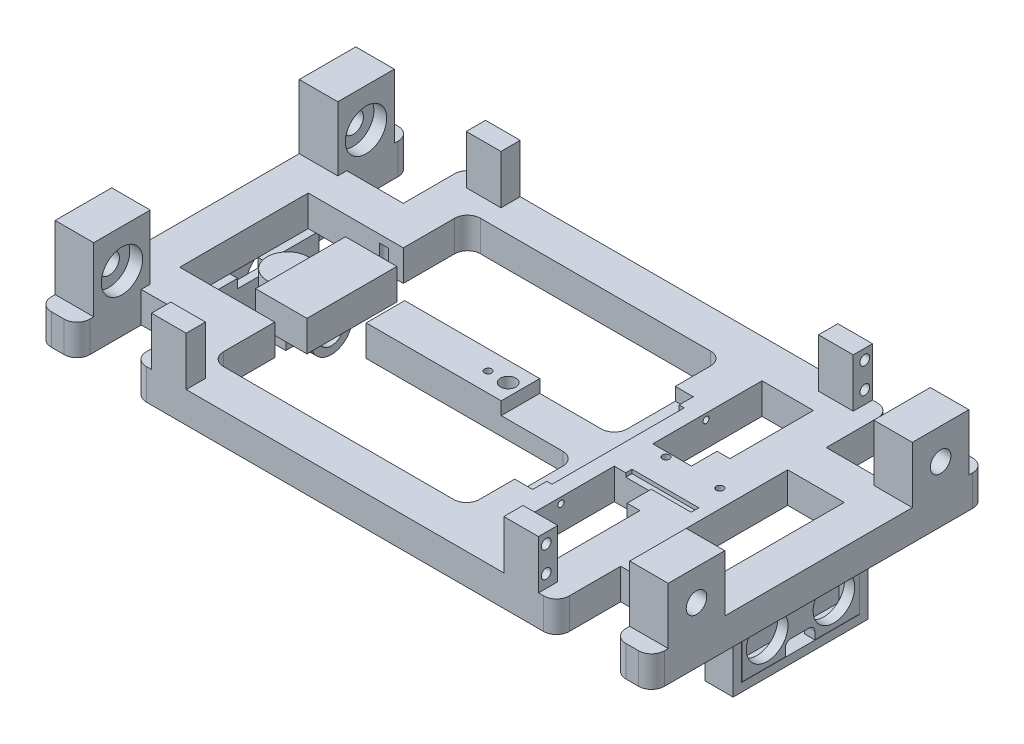
from build123d import *
from build123d.topology import SkipClean

# Parameters (mm, degrees)
BOSS_EXTRUDE1_DEPTH    = 12
SKETCH2_W              = 12
SKETCH2_H              = 7.5
BOSS_EXTRUDE2_DEPTH    = 19
SKETCH3_R              = 1.9
CUT_EXTRUDE1_DEPTH     = 208.497373477
SKETCH4_W              = 22
SKETCH4_H              = 22
SKETCH4_R              = 8.05
BOSS_EXTRUDE3_DEPTH    = 5
BOSS_EXTRUDE3_2_DEPTH  = 5
SKETCH6_W              = 22
SKETCH6_H              = 22
SKETCH6_R              = 4
BOSS_EXTRUDE4_DEPTH    = 6
SKETCH7_W              = 22
SKETCH7_H              = 15
BOSS_EXTRUDE5_DEPTH    = 12
SKETCH8_W              = 22
SKETCH8_H              = 50
CUT_EXTRUDE2_DEPTH     = 138.628085796
SKETCH14_W             = 15
SKETCH14_H             = 42.5
BOSS_EXTRUDE8_DEPTH    = 12
SKETCH16_W             = 15
SKETCH16_H             = 42.5
CUT_EXTRUDE8_DEPTH     = 138.628085796
SKETCH17_W             = 15
SKETCH17_H             = 42.5
BOSS_EXTRUDE9_DEPTH    = 12
SKETCH15_W             = 36
SKETCH15_H             = 62.5
CUT_EXTRUDE9_DEPTH     = 5
CUT_EXTRUDE10_REACH    = 176.743
SKETCH18_R             = 1.2
SKETCH19_W             = 51.5
SKETCH19_H             = 7
CUT_EXTRUDE11_DEPTH    = 2
SKETCH41_W             = 3
SKETCH41_H             = 52.5
BOSS_EXTRUDE18_DEPTH   = 24
BOSS_EXTRUDE19_DEPTH   = 8
BOSS_EXTRUDE22_START   = 5
SKETCH48_R             = 8.1
BOSS_EXTRUDE22_DEPTH   = 4
SKETCH55_W             = 1.5
SKETCH55_H             = 7.5
BOSS_EXTRUDE27_DEPTH   = 19
CUT_EXTRUDE27_DEPTH    = 3
SKETCH60_W             = 11
SKETCH60_H             = 22
BOSS_EXTRUDE28_DEPTH   = 3
SKETCH62_R             = 1.825
CUT_EXTRUDE33_DEPTH    = 9
FILLET4_R              = 5
SKETCH65_W             = 22
SKETCH65_H             = 22
SKETCH65_R             = 4
BOSS_EXTRUDE29_DEPTH   = 4
SKETCH66_W             = 22
SKETCH66_H             = 25
SKETCH66_R             = 4
BOSS_EXTRUDE30_DEPTH   = 4
BOSS_EXTRUDE32_DEPTH   = 1
BOSS_EXTRUDE33_DEPTH   = 1
SKETCH67_W             = 56
SKETCH67_H             = 15
BOSS_EXTRUDE34_DEPTH   = 11
SKETCH70_W             = 12
SKETCH70_H             = 8
CUT_EXTRUDE35_DEPTH    = 13
SKETCH71_W             = 26
SKETCH71_H             = 16.2
CUT_EXTRUDE36_DEPTH    = 19
SKETCH72_W             = 26
SKETCH72_H             = 3
CUT_EXTRUDE37_DEPTH    = 1.5
SKETCH73_R             = 1.4
CUT_EXTRUDE38_DEPTH    = 10
SKETCH74_W             = 6
SKETCH74_H             = 9
BOSS_EXTRUDE35_DEPTH   = 2.5
SKETCH75_W             = 6
SKETCH75_H             = 3
BOSS_EXTRUDE36_DEPTH   = 2.5
BOSS_EXTRUDE36_2_DEPTH = 2.5
SKETCH76_W             = 6
SKETCH76_H             = 12.35
SKETCH76_H_2           = 0.35
SKETCH76_H_3           = 3
BOSS_EXTRUDE37_DEPTH   = 2.7
BOSS_EXTRUDE38_DEPTH   = 6
SKETCH78_W             = 2
SKETCH78_H             = 2
CUT_EXTRUDE39_DEPTH    = 6
SKETCH79_W             = 13.5
SKETCH79_H             = 15.7
BOSS_EXTRUDE39_DEPTH   = 3
SKETCH80_R             = 2.75
CUT_EXTRUDE40_DEPTH    = 3
SKETCH81_R             = 1.4
CUT_EXTRUDE41_DEPTH    = 20
SKETCH82_W             = 6
SKETCH82_H             = 3
CUT_EXTRUDE42_DEPTH    = 5
SKETCH83_W             = 6
SKETCH83_H             = 3
BOSS_EXTRUDE40_DEPTH   = 5
SKETCH84_R             = 3
CUT_EXTRUDE43_DEPTH    = 12
SKETCH85_W             = 7.5
SKETCH85_H             = 5
BOSS_EXTRUDE42_DEPTH   = 7.5
SKETCH86_R             = 2.75
CUT_EXTRUDE44_DEPTH    = 3
SKETCH89_R             = 0.95
CUT_EXTRUDE47_DEPTH    = 8
SKETCH91_R             = 1.75
CUT_EXTRUDE48_DEPTH    = 1.5
SKETCH88_R             = 1.4
CUT_EXTRUDE49_DEPTH    = 10
BOSS_EXTRUDE43_DEPTH   = 12
SKETCH96_W             = 7.5
SKETCH96_H             = 5
BOSS_EXTRUDE44_DEPTH   = 7.5
SKETCH100_W            = 7.5
SKETCH100_H            = 5
BOSS_EXTRUDE45_DEPTH   = 7.5
SKETCH98_R             = 2.75
CUT_EXTRUDE52_DEPTH    = 3
SKETCH101_R            = 1.4
CUT_EXTRUDE53_DEPTH    = 10
BOSS_EXTRUDE46_DEPTH   = 7.5
BOSS_EXTRUDE47_START   = 5
BOSS_EXTRUDE47_DEPTH   = 5
SKETCH104_W            = 55.051082791
SKETCH104_H            = 50.028748178
CUT_EXTRUDE55_DEPTH    = 141.806569449
SKETCH105_W            = 73
SKETCH105_H            = 25
CUT_EXTRUDE56_DEPTH    = 216.02688204


with BuildPart() as part:
    # Sketch1 → Boss-Extrude1 (new body)
    with BuildSketch(Plane(origin=(0, 0, 0), x_dir=(1, 0, 0), z_dir=(0, 1, 0))):
        Polygon((-104.3, -65), (-104.3, -7.5), (-82.3, -7.5), (-82.3, -65), (82.3, -65), (82.3, -7.5), (104.3, -7.5), (104.3, -65), (119.3, -65), (119.3, 65), (104.3, 65), (104.3, 7.5), (82.3, 7.5), (82.3, 65), (-82.3, 65), (-82.3, 7.5), (-104.3, 7.5), (-104.3, 65), (-119.3, 65), (-119.3, -65), align=None)
        Polygon((-67.3, -50), (-67.3, -17.5), (-63.3, -17.5), (-63.3, -7.5), (63.3, -7.5), (63.3, -17.5), (67.3, -17.5), (67.3, -50), align=None, mode=Mode.SUBTRACT)
        Polygon((-67.3, 17.5), (-63.3, 17.5), (-63.3, 7.5), (63.3, 7.5), (63.3, 17.5), (67.3, 17.5), (67.3, 50), (-67.3, 50), align=None, mode=Mode.SUBTRACT)
    extrude(amount=BOSS_EXTRUDE1_DEPTH)

    # Sketch2 → Boss-Extrude2 (add)
    with BuildSketch(Plane(origin=(0, 12, 0), x_dir=(1, 0, 0), z_dir=(0, 1, 0))):
        with Locations((-69.3, 61.25)):
            Rectangle(SKETCH2_W, SKETCH2_H)
        with Locations((-69.3, -61.25)):
            Rectangle(SKETCH2_W, SKETCH2_H)
        Polygon((-63.3, -7.5), (-63.3, 0), (-63.3, 7.5), (-63.3, 17.5), (-75.3, 17.5), (-75.3, 7.5), (-75.3, 0), (-75.3, -7.5), (-75.3, -17.5), (-63.3, -17.5), align=None)
        with Locations((69.3, -61.25)):
            Rectangle(SKETCH2_W, SKETCH2_H)
        Polygon((75.3, 7.5), (75.3, 0), (75.3, -7.5), (75.3, -17.5), (63.3, -17.5), (63.3, -7.5), (63.3, 0), (63.3, 7.5), (63.3, 17.5), (75.3, 17.5), align=None)
        with Locations((69.3, 61.25)):
            Rectangle(SKETCH2_W, SKETCH2_H)
    extrude(amount=BOSS_EXTRUDE2_DEPTH)

    # Sketch3 → Cut-Extrude1 (cut, through all)
    with BuildSketch(Plane.ZY.offset(75.3)):
        with Locations((-62, 17)):
            Circle(SKETCH3_R)
        with Locations((-62, 27)):
            Circle(SKETCH3_R)
        with Locations((-13, 17)):
            Circle(SKETCH3_R)
        with Locations((-13, 27)):
            Circle(SKETCH3_R)
        with Locations((13, 27)):
            Circle(SKETCH3_R)
        with Locations((13, 17)):
            Circle(SKETCH3_R)
        with Locations((62, 17)):
            Circle(SKETCH3_R)
        with Locations((62, 27)):
            Circle(SKETCH3_R)
    extrude(amount=-CUT_EXTRUDE1_DEPTH, mode=Mode.SUBTRACT)



with BuildPart() as body_2:
    # Sketch4 → Boss-Extrude3 (new body)
    with BuildSketch(Plane.ZY.offset(-104.3)):
        with Locations((-47.5, 23)):
            Rectangle(SKETCH4_W, SKETCH4_H)
        with Locations(Location((-47.5, 22, 0), (0, 0, 180))):
            Circle(SKETCH4_R, mode=Mode.SUBTRACT)
    extrude(amount=-BOSS_EXTRUDE3_DEPTH)


with BuildPart() as body_3:
    # Sketch4 → Boss-Extrude3 2 (new body)
    with BuildSketch(Plane.ZY.offset(-104.3)):
        with Locations((47.5, 23)):
            Rectangle(SKETCH4_W, SKETCH4_H)
        with Locations((47.5, 22)):
            Circle(SKETCH4_R, mode=Mode.SUBTRACT)
    extrude(amount=-BOSS_EXTRUDE3_2_DEPTH)


    add(body_2.part)  # Boss-Extrude4 merges body 2
    # Sketch6 → Boss-Extrude4 (add)
    # profile 1 of 2: a face of its own
    with BuildSketch(Plane(origin=(109.3, 0, 0), x_dir=(0, 0, -1), z_dir=(1, 0, 0))):
        with Locations((-47.5, 23)):
            Rectangle(SKETCH6_W, SKETCH6_H)
        with Locations((-47.5, 22)):
            Circle(SKETCH6_R, mode=Mode.SUBTRACT)
    # profile 2 of 2: a face of its own
    with BuildSketch(Plane(origin=(109.3, 0, 0), x_dir=(0, 0, -1), z_dir=(1, 0, 0))):
        with Locations((47.5, 23)):
            Rectangle(SKETCH6_W, SKETCH6_H)
        with Locations((47.5, 22)):
            Circle(SKETCH6_R, mode=Mode.SUBTRACT)
    extrude(amount=BOSS_EXTRUDE4_DEPTH)


with BuildPart() as body_3_2:
    # Mirror1: mirrored copy
    add(body_3.part.mirror(Plane(origin=(0, 0, 0), x_dir=(0, 0, 1), z_dir=(1, 0, 0))))


with BuildPart() as part_1:
    add(part.part)

    add(body_3.part)  # Boss-Extrude5 merges body 3

    add(body_3_2.part)  # Boss-Extrude5 merges body 3 2
    # Sketch7 → Boss-Extrude5 (add)
    with BuildSketch(Plane(origin=(0, 0, 0), x_dir=(1, 0, 0), z_dir=(0, 1, 0))):
        with Locations((-93.3, 32.5)):
            Rectangle(SKETCH7_W, SKETCH7_H)
        with Locations((93.3, 32.5)):
            Rectangle(SKETCH7_W, SKETCH7_H)
        with Locations((93.3, -32.5)):
            Rectangle(SKETCH7_W, SKETCH7_H)
        with Locations((-93.3, -32.5)):
            Rectangle(SKETCH7_W, SKETCH7_H)
    extrude(amount=BOSS_EXTRUDE5_DEPTH)

    # Sketch8 → Cut-Extrude2 (cut, through all)
    with BuildSketch(Plane(origin=(0, 12, 0), x_dir=(1, 0, 0), z_dir=(0, 1, 0))):
        with Locations((-93.3, 0)):
            Rectangle(SKETCH8_W, SKETCH8_H)
        with Locations((93.3, 0)):
            Rectangle(SKETCH8_W, SKETCH8_H)
    extrude(amount=-CUT_EXTRUDE2_DEPTH, mode=Mode.SUBTRACT)

    # Sketch14 → Boss-Extrude8 (add)
    with BuildSketch(Plane(origin=(0, 0, 0), x_dir=(1, 0, 0), z_dir=(0, 1, 0))):
        with Locations((0, -28.75)):
            Rectangle(SKETCH14_W, SKETCH14_H)
        with Locations((0, 28.75)):
            Rectangle(SKETCH14_W, SKETCH14_H)
    extrude(amount=BOSS_EXTRUDE8_DEPTH)

    # Sketch16 → Cut-Extrude8 (cut, through all)
    with BuildSketch(Plane(origin=(0, 12, 0), x_dir=(1, 0, 0), z_dir=(0, 1, 0))):
        with Locations((0, 28.75)):
            Rectangle(SKETCH16_W, SKETCH16_H)
        with Locations((0, -28.75)):
            Rectangle(SKETCH16_W, SKETCH16_H)
    extrude(amount=-CUT_EXTRUDE8_DEPTH, mode=Mode.SUBTRACT)

    # Sketch17 → Boss-Extrude9 (add)
    with BuildSketch(Plane(origin=(0, 0, 0), x_dir=(1, 0, 0), z_dir=(0, 1, 0))):
        with Locations((39.800000001, 28.75)):
            Rectangle(SKETCH17_W, SKETCH17_H)
        with Locations((39.800000001, -28.75)):
            Rectangle(SKETCH17_W, SKETCH17_H)
    extrude(amount=BOSS_EXTRUDE9_DEPTH)

    # Sketch15 → Cut-Extrude9 (cut)
    with BuildSketch(Plane(origin=(0, 12, 0), x_dir=(1, 0, 0), z_dir=(0, 1, 0))):
        with Locations((21.3, 0)):
            Rectangle(SKETCH15_W, SKETCH15_H)
    extrude(amount=-CUT_EXTRUDE9_DEPTH, mode=Mode.SUBTRACT)

    # Sketch18 → Cut-Extrude10 (cut, up to next)
    with BuildSketch(Plane.ZY.offset(-39.3), mode=Mode.PRIVATE) as cut_extrude10_sk1:
        with Locations((28.25, 9.7)):
            Circle(SKETCH18_R)
    cut_extrude10_tool1 = extrude(cut_extrude10_sk1.sketch, amount=-CUT_EXTRUDE10_REACH, mode=Mode.PRIVATE) & part_1.part
    # Sketch18 → Cut-Extrude10 (cut, up to next)
    with BuildSketch(Plane.ZY.offset(-39.3), mode=Mode.PRIVATE) as cut_extrude10_sk2:
        with Locations((-28.25, 9.7)):
            Circle(SKETCH18_R)
    cut_extrude10_tool2 = extrude(cut_extrude10_sk2.sketch, amount=-CUT_EXTRUDE10_REACH, mode=Mode.PRIVATE) & part_1.part
    add(cut_extrude10_tool1.solids().sort_by_distance((39.3, 9.7, 28.25))[0], mode=Mode.SUBTRACT)
    add(cut_extrude10_tool2.solids().sort_by_distance((39.3, 9.7, -28.25))[0], mode=Mode.SUBTRACT)

    # Sketch19 → Cut-Extrude11 (cut)
    with BuildSketch(Plane.ZY.offset(-39.3)):
        with Locations((0, 10.5)):
            Rectangle(SKETCH19_W, SKETCH19_H)
    extrude(amount=-CUT_EXTRUDE11_DEPTH, mode=Mode.SUBTRACT)

    # Sketch55 → Boss-Extrude27 (add)
    with BuildSketch(Plane(origin=(0, 12, 0), x_dir=(1, 0, 0), z_dir=(0, 1, 0))):
        with Locations((-62.55, 61.25)):
            Rectangle(SKETCH55_W, SKETCH55_H)
        with Locations((62.55, 61.25)):
            Rectangle(SKETCH55_W, SKETCH55_H)
        with Locations((62.55, -61.25)):
            Rectangle(SKETCH55_W, SKETCH55_H)
        with Locations((-62.55, -61.25)):
            Rectangle(SKETCH55_W, SKETCH55_H)
    extrude(amount=BOSS_EXTRUDE27_DEPTH)

    # Sketch60 → Boss-Extrude28 (add)
    with BuildSketch(Plane(origin=(0, 34, 0), x_dir=(1, 0, 0), z_dir=(0, 1, 0))):
        with Locations((-109.8, 47.5)):
            Rectangle(SKETCH60_W, SKETCH60_H)
        with Locations((-109.8, -47.5)):
            Rectangle(SKETCH60_W, SKETCH60_H)
    extrude(amount=BOSS_EXTRUDE28_DEPTH)

    # Sketch62 → Cut-Extrude33 (cut)
    with BuildSketch(Plane.XZ):
        with Locations(Location((-74.8, 25, 0), (0, 0, 270))):
            Circle(SKETCH62_R)
        with Locations(Location((-74.8, -25, 0), (0, 0, 270))):
            Circle(SKETCH62_R)
        with Locations(Location((-74.8, -57.5, 0), (0, 0, 270))):
            Circle(SKETCH62_R)
        with Locations(Location((-74.8, 57.5, 0), (0, 0, 270))):
            Circle(SKETCH62_R)
        with Locations(Location((0, 57.5, 0), (0, 0, 270))):
            Circle(SKETCH62_R)
        with Locations(Location((0, -57.5, 0), (0, 0, 270))):
            Circle(SKETCH62_R)
        with Locations(Location((74.8, -57.5, 0), (0, 0, 90))):
            Circle(SKETCH62_R)
        with Locations(Location((74.8, -25, 0), (0, 0, 90))):
            Circle(SKETCH62_R)
        with Locations(Location((74.8, 25, 0), (0, 0, 90))):
            Circle(SKETCH62_R)
        with Locations(Location((74.8, 57.5, 0), (0, 0, 90))):
            Circle(SKETCH62_R)
    extrude(amount=-CUT_EXTRUDE33_DEPTH, mode=Mode.SUBTRACT)

    # Fillet4
    fillet4_edges = [part_1.edges().sort_by_distance(p)[0] for p in [
        (-119.3, 6, -65),
        (-104.3, 6, -65),
        (-82.3, 6, -65),
        (82.3, 6, -65),
        (104.3, 6, -65),
        (119.3, 6, -65),
        (119.3, 6, 65),
        (104.3, 6, 65),
        (82.3, 6, 65),
        (-82.3, 6, 65),
        (-104.3, 6, 65),
        (-119.3, 6, 65),
        (32.300000001, 6, -50),
        (32.300000001, 6, 50),
        (32.300000001, 3.5, 7.5),
        (32.300000001, 3.5, -7.5),
        (-67.3, 6, 50),
        (-67.3, 6, -50),
    ]]
    fillet(fillet4_edges, radius=FILLET4_R)

    # Sketch65 → Boss-Extrude29 (add)
    # profile 1 of 2: a face of its own
    with BuildSketch(Plane(origin=(115.3, 0, 0), x_dir=(0, 0, -1), z_dir=(1, 0, 0))):
        with Locations((-47.5, 23)):
            Rectangle(SKETCH65_W, SKETCH65_H)
        with Locations(Location((-47.5, 22, 0), (0, 0, 180))):
            Circle(SKETCH65_R, mode=Mode.SUBTRACT)
    # profile 2 of 2: a face of its own
    with BuildSketch(Plane(origin=(115.3, 0, 0), x_dir=(0, 0, -1), z_dir=(1, 0, 0))):
        with Locations((47.5, 23)):
            Rectangle(SKETCH65_W, SKETCH65_H)
        with Locations(Location((47.5, 22, 0), (0, 0, 180))):
            Circle(SKETCH65_R, mode=Mode.SUBTRACT)
    extrude(amount=BOSS_EXTRUDE29_DEPTH)

    # Sketch66 → Boss-Extrude30 (add)
    # profile 1 of 2: a face of its own
    with SkipClean():  # the faces are left unmerged after this step: merging them gives an invalid solid
        with BuildSketch(Plane.ZY.offset(115.3)):
            with Locations((-47.5, 24.5)):
                Rectangle(SKETCH66_W, SKETCH66_H)
            with Locations((-47.5, 22)):
                Circle(SKETCH66_R, mode=Mode.SUBTRACT)
        # profile 2 of 2: a face of its own
        with BuildSketch(Plane.ZY.offset(115.3)):
            with Locations((47.5, 24.5)):
                Rectangle(SKETCH66_W, SKETCH66_H)
            with Locations((47.5, 22)):
                Circle(SKETCH66_R, mode=Mode.SUBTRACT)
        extrude(amount=BOSS_EXTRUDE30_DEPTH)
    add(part_1.part.scale(1), mode=Mode.REPLACE)  # the faces are merged on a copy

    # Sketch68 → Boss-Extrude32 (add)
    with SkipClean():  # the faces are left unmerged after this step: merging them gives an invalid solid
        with BuildSketch(Plane(origin=(-63.3, 0, 0), x_dir=(0, 0, -1), z_dir=(1, 0, 0))):
            Polygon((-17.5, 0), (-7.5, 0), (-7.5, 12), (7.5, 12), (7.5, 0), (17.5, 0), (17.5, 31), (-17.5, 31), align=None)
        extrude(amount=BOSS_EXTRUDE32_DEPTH)

    # Sketch69 → Boss-Extrude33 (add)
    with SkipClean():  # the faces are left unmerged after this step: merging them gives an invalid solid
        with BuildSketch(Plane.ZY.offset(-63.3)):
            Polygon((7.5, 0), (17.5, 0), (17.5, 31), (-17.5, 31), (-17.5, 0), (-7.5, 0), (-7.5, 12), (7.5, 12), align=None)
        extrude(amount=BOSS_EXTRUDE33_DEPTH)

    # Sketch67 → Boss-Extrude34 (add)
    with SkipClean():  # the faces are left unmerged after this step: merging them gives an invalid solid
        with BuildSketch(Plane(origin=(0, 12, 0), x_dir=(1, 0, 0), z_dir=(0, 1, 0))):
            with Locations((-34.3, 0)):
                Rectangle(SKETCH67_W, SKETCH67_H)
        extrude(amount=BOSS_EXTRUDE34_DEPTH)

    # Sketch70 → Cut-Extrude35 (cut)
    with SkipClean():  # the faces are left unmerged after this step: merging them gives an invalid solid
        with BuildSketch(Plane.ZY.offset(75.3)):
            with Locations((0, 27)):
                Rectangle(SKETCH70_W, SKETCH70_H)
        extrude(amount=-CUT_EXTRUDE35_DEPTH, mode=Mode.SUBTRACT)

    # Sketch71 → Cut-Extrude36 (cut)
    with SkipClean():  # the faces are left unmerged after this step: merging them gives an invalid solid
        with BuildSketch(Plane(origin=(0, 31, 0), x_dir=(1, 0, 0), z_dir=(0, 1, 0))):
            with Locations((69.3, 0)):
                Rectangle(SKETCH71_W, SKETCH71_H)
        extrude(amount=-CUT_EXTRUDE36_DEPTH, mode=Mode.SUBTRACT)

    # Sketch72 → Cut-Extrude37 (cut)
    with SkipClean():  # the faces are left unmerged after this step: merging them gives an invalid solid
        with BuildSketch(Plane(origin=(0, 12, 0), x_dir=(1, 0, 0), z_dir=(0, 1, 0))):
            with Locations((64.8, -6.6)):
                Rectangle(SKETCH72_W, SKETCH72_H)
        extrude(amount=-CUT_EXTRUDE37_DEPTH, mode=Mode.SUBTRACT)

    # Sketch73 → Cut-Extrude38 (cut)
    with SkipClean():  # the faces are left unmerged after this step: merging them gives an invalid solid
        with BuildSketch(Plane(origin=(0, 12, 0), x_dir=(1, 0, 0), z_dir=(0, 1, 0))):
            with Locations(Location((54.3, 5.6, 0), (0, 0, 270))):
                Circle(SKETCH73_R)
            with Locations(Location((75.3, 5.6, 0), (0, 0, 270))):
                Circle(SKETCH73_R)
        extrude(amount=-CUT_EXTRUDE38_DEPTH, mode=Mode.SUBTRACT)

    # Sketch74 → Boss-Extrude35 (add)
    with SkipClean():  # the faces are left unmerged after this step: merging them gives an invalid solid
        with BuildSketch(Plane(origin=(0, 23, 0), x_dir=(1, 0, 0), z_dir=(0, 1, 0))):
            with Locations((-9.3, 0)):
                Rectangle(SKETCH74_W, SKETCH74_H)
        extrude(amount=BOSS_EXTRUDE35_DEPTH)


with BuildPart() as body_2_2:
    # Sketch41 → Boss-Extrude18 (new body)
    with BuildSketch(Plane.XZ):
        with Locations((102.8, 0)):
            Rectangle(SKETCH41_W, SKETCH41_H)
    extrude(amount=BOSS_EXTRUDE18_DEPTH)

    # Sketch42 → Boss-Extrude19 (add)
    with BuildSketch(Plane(origin=(104.3, 0, 0), x_dir=(0, 0, -1), z_dir=(1, 0, 0))):
        Polygon((-22.95, 0), (-26.25, 0), (-26.25, -24), (26.25, -24), (26.25, 0), (22.95, 0), (22.95, -20.7), (-22.95, -20.7), align=None)
    extrude(amount=BOSS_EXTRUDE19_DEPTH)

    # Sketch42<4> → Cut-Extrude27 (cut)
    with BuildSketch(Plane(origin=(104.3, 0, 0), x_dir=(0, 0, -1), z_dir=(1, 0, 0))):
        Polygon((5.5, 0), (-5.5, 0), (-5.5, -3.3), (-5.5, -3.5), (5.5, -3.5), (5.5, -3.3), align=None)
    extrude(amount=-CUT_EXTRUDE27_DEPTH, mode=Mode.SUBTRACT)

    # Sketch85 → Boss-Extrude42 (add)
    with BuildSketch(Plane(origin=(0, 0, -26.25), x_dir=(-1, 0, 0), z_dir=(0, 0, -1))):
        with Locations((-106.8, -2.5)):
            Rectangle(SKETCH85_W, SKETCH85_H)
    boss_extrude42 = extrude(amount=BOSS_EXTRUDE42_DEPTH)

    # Sketch86 → Cut-Extrude44 (cut)
    with BuildSketch(Plane.XZ.offset(5)):
        with Locations((106.8, -30)):
            Circle(SKETCH86_R)
    cut_extrude44 = extrude(amount=-CUT_EXTRUDE44_DEPTH, mode=Mode.SUBTRACT)

    # Mirror11: Boss-Extrude42 across plane
    add(boss_extrude42.mirror(Plane.XY))

    # Mirror11 2: Cut-Extrude44 across plane
    add(cut_extrude44.mirror(Plane.XY), mode=Mode.SUBTRACT)


with BuildPart() as body_3_3:
    # Sketch48 → Boss-Extrude22 (new body)
    with BuildSketch(Plane(origin=(104.3, 0, 0), x_dir=(0, 0, -1), z_dir=(1, 0, 0)).offset(BOSS_EXTRUDE22_START)):
        with BuildLine():
            Line((-5.25, -2.5), (-5.25, -0.1))
            Line((-5.25, -0.1), (-22.85, -0.1))
            Line((-22.85, -0.1), (-22.85, -20.6))
            Line((-22.85, -20.6), (-5.95, -20.6))
            Line((-5.95, -20.6), (-5.95, -17.7))
            ThreePointArc((-5.95, -17.7), (-5.305634919, -16.144365081), (-3.75, -15.5))
            Line((-3.75, -15.5), (3.35, -15.5))
            ThreePointArc((3.35, -15.5), (4.905634919, -16.144365081), (5.55, -17.7))
            Line((5.55, -17.7), (5.55, -20.6))
            Line((5.55, -20.6), (22.85, -20.6))
            Line((22.85, -20.6), (22.85, -0.1))
            Line((22.85, -0.1), (5.25, -0.1))
            Line((5.25, -0.1), (5.25, -2.462687551))
            ThreePointArc((5.25, -2.462687551), (4.824235227, -3.547385155), (3.750464145, -4))
            Line((3.750464145, -4), (-3.75, -4))
            ThreePointArc((-3.75, -4), (-4.810660172, -3.560660172), (-5.25, -2.5))
        make_face()
        with Locations((-13, -10.5)):
            Circle(SKETCH48_R, mode=Mode.SUBTRACT)
        with Locations((13, -10.5)):
            Circle(SKETCH48_R, mode=Mode.SUBTRACT)
    extrude(amount=BOSS_EXTRUDE22_DEPTH)


with BuildPart() as body_3_3_1:
    # Body-Move/Copy1: moved
    add(body_3_3.part.moved(Location((-1, 0, 0))))


with BuildPart() as body_4:
    # Sketch75 → Boss-Extrude36 (new body)
    with BuildSketch(Plane(origin=(0, 23, 0), x_dir=(1, 0, 0), z_dir=(0, 1, 0))):
        with Locations((-9.3, 6)):
            Rectangle(SKETCH75_W, SKETCH75_H)
    extrude(amount=BOSS_EXTRUDE36_DEPTH)


with BuildPart() as body_5:
    # Sketch75 → Boss-Extrude36 2 (new body)
    with BuildSketch(Plane(origin=(0, 23, 0), x_dir=(1, 0, 0), z_dir=(0, 1, 0))):
        with Locations((-9.3, -6)):
            Rectangle(SKETCH75_W, SKETCH75_H)
    extrude(amount=BOSS_EXTRUDE36_2_DEPTH)


    add(body_4.part)  # Boss-Extrude37 merges body 4
    # Sketch76 → Boss-Extrude37 (add)
    with BuildSketch(Plane(origin=(0, 25.5, 0), x_dir=(1, 0, 0), z_dir=(0, 1, 0))):
        Polygon((-32.95, -7.85), (-30.8, -7.85), (-30.8, 7.85), (-30.8, 10), (-32.95, 10), align=None)
        Polygon((-30.8, 10), (-30.8, 7.85), (-12.3, 7.85), (-6.3, 7.85), (-6.3, 10), align=None)
        with Locations((-9.3, 1.675)):
            Rectangle(SKETCH76_W, SKETCH76_H)
        Polygon((-6.3, -7.85), (-12.3, -7.85), (-30.8, -7.85), (-32.95, -7.85), (-32.95, -10), (-6.3, -10), align=None)
        with Locations((-9.3, -7.675)):
            Rectangle(SKETCH76_W, SKETCH76_H_2)
        with Locations((-9.3, -6)):
            Rectangle(SKETCH76_W, SKETCH76_H_3)
    extrude(amount=BOSS_EXTRUDE37_DEPTH)

    # Sketch77 → Boss-Extrude38 (add)
    with BuildSketch(Plane(origin=(-6.3, 0, 0), x_dir=(0, 0, -1), z_dir=(1, 0, 0))):
        Polygon((-10, 25.5), (-7.5, 23), (-7.5, 25.5), align=None)
        Polygon((7.5, 23), (7.5, 25.5), (10, 25.5), align=None)
    extrude(amount=-BOSS_EXTRUDE38_DEPTH)

    # Sketch78 → Cut-Extrude39 (cut)
    with BuildSketch(Plane(origin=(-6.3, 0, 0), x_dir=(0, 0, -1), z_dir=(1, 0, 0))):
        with Locations((-6.85, 27.2)):
            Rectangle(SKETCH78_W, SKETCH78_H)
    extrude(amount=-CUT_EXTRUDE39_DEPTH, mode=Mode.SUBTRACT)

    # Sketch79 → Boss-Extrude39 (add)
    with BuildSketch(Plane(origin=(0, 28.2, 0), x_dir=(1, 0, 0), z_dir=(0, 1, 0))):
        Polygon((-12.3, -5.85), (-12.3, -7.85), (-6.3, -7.85), (-6.3, -10), (-32.95, -10), (-32.95, 10), (-6.3, 10), (-6.3, -5.85), align=None)
        with Locations((-24.05, 0)):
            Rectangle(SKETCH79_W, SKETCH79_H, mode=Mode.SUBTRACT)
    extrude(amount=BOSS_EXTRUDE39_DEPTH)

    # Sketch80 → Cut-Extrude40 (cut)
    with BuildSketch(Plane(origin=(0, 31.2, 0), x_dir=(1, 0, 0), z_dir=(0, 1, 0))):
        with Locations(Location((-9.3, 0, 0), (0, 0, 270))):
            Circle(SKETCH80_R)
    extrude(amount=-CUT_EXTRUDE40_DEPTH, mode=Mode.SUBTRACT)


with BuildPart() as cut_extrude41_tool:
    # Sketch81 → Cut-Extrude41 (new body)
    with SkipClean():  # the faces are left unmerged after this step: merging them gives an invalid solid
        with BuildSketch(Plane(origin=(0, 28.2, 0), x_dir=(1, 0, 0), z_dir=(0, 1, 0))):
            with Locations(Location((-9.3, 0, 0), (0, 0, 270))):
                Circle(SKETCH81_R)
        extrude(amount=-CUT_EXTRUDE41_DEPTH)


with BuildPart() as part_2:
    with SkipClean():  # the faces are left unmerged after this step: merging them gives an invalid solid
        add(part_1.part)

        # Cut-Extrude41: cut by cut_extrude41_tool
        add(cut_extrude41_tool.part, mode=Mode.SUBTRACT)

    # Sketch82 → Cut-Extrude42 (cut)
    with SkipClean():  # the faces are left unmerged after this step: merging them gives an invalid solid
        with BuildSketch(Plane(origin=(0, 23, 0), x_dir=(1, 0, 0), z_dir=(0, 1, 0))):
            with Locations((-9.3, 6)):
                Rectangle(SKETCH82_W, SKETCH82_H)
            with Locations((-9.3, -6)):
                Rectangle(SKETCH82_W, SKETCH82_H)
        extrude(amount=-CUT_EXTRUDE42_DEPTH, mode=Mode.SUBTRACT)

    # Sketch84 → Cut-Extrude43 (cut)
    with SkipClean():  # the faces are left unmerged after this step: merging them gives an invalid solid
        with BuildSketch(Plane(origin=(0, 12, 0), x_dir=(1, 0, 0), z_dir=(0, 1, 0))):
            with Locations(Location((-1.5, 0, 0), (0, 0, 270))):
                Circle(SKETCH84_R)
        extrude(amount=-CUT_EXTRUDE43_DEPTH, mode=Mode.SUBTRACT)


with BuildPart() as body_5_1:
    with SkipClean():  # the faces are left unmerged after this step: merging them gives an invalid solid
        add(body_5.part)

        # Cut-Extrude41: cut by cut_extrude41_tool
        add(cut_extrude41_tool.part, mode=Mode.SUBTRACT)

    # Sketch83 → Boss-Extrude40 (add)
    with BuildSketch(Plane.XZ.offset(-23)):
        with Locations((-9.3, 6)):
            Rectangle(SKETCH83_W, SKETCH83_H)
        with Locations((-9.3, -6)):
            Rectangle(SKETCH83_W, SKETCH83_H)
    extrude(amount=BOSS_EXTRUDE40_DEPTH)


with BuildPart() as cut_extrude47_tool:
    # Sketch89 → Cut-Extrude47 (new body)
    with BuildSketch(Plane.XZ.offset(24)):
        with Locations(Location((110.3, 20.85, 0), (0, 0, 270))):
            Circle(SKETCH89_R)
        with Locations(Location((110.3, -20.85, 0), (0, 0, 90))):
            Circle(SKETCH89_R)
    extrude(amount=-CUT_EXTRUDE47_DEPTH)


with BuildPart() as body_2_2_1:
    add(body_2_2.part)

    # Cut-Extrude47: cut by cut_extrude47_tool
    add(cut_extrude47_tool.part, mode=Mode.SUBTRACT)

    # Sketch91 → Cut-Extrude48 (cut)
    with BuildSketch(Plane.XZ.offset(24)):
        with Locations(Location((110.3, 20.85, 0), (0, 0, 270))):
            Circle(SKETCH91_R)
        with Locations(Location((110.3, -20.85, 0), (0, 0, 270))):
            Circle(SKETCH91_R)
    extrude(amount=-CUT_EXTRUDE48_DEPTH, mode=Mode.SUBTRACT)


with BuildPart() as body_3_3_2:
    add(body_3_3_1.part)

    # Cut-Extrude47: cut by cut_extrude47_tool
    add(cut_extrude47_tool.part, mode=Mode.SUBTRACT)


with BuildPart() as body_5_2:
    # Mirror12: mirrored copy
    add(body_2_2_1.part.mirror(Plane(origin=(0, 0, 0), x_dir=(0, 0, 1), z_dir=(1, 0, 0))))


with BuildPart() as body_6:
    # Mirror12 2: mirrored copy
    add(body_3_3_2.part.mirror(Plane(origin=(0, 0, 0), x_dir=(0, 0, 1), z_dir=(1, 0, 0))))


with BuildPart() as cut_extrude49_tool:
    # Sketch88 → Cut-Extrude49 (new body)
    with SkipClean():  # the faces are left unmerged after this step: merging them gives an invalid solid
        with BuildSketch(Plane.XZ.offset(2)):
            with Locations((106.8, 30)):
                Circle(SKETCH88_R)
            with Locations((106.8, -30)):
                Circle(SKETCH88_R)
            with Locations((-106.8, -30)):
                Circle(SKETCH88_R)
            with Locations((-106.8, 30)):
                Circle(SKETCH88_R)
        extrude(amount=-CUT_EXTRUDE49_DEPTH)


with BuildPart() as part_3:
    with SkipClean():  # the faces are left unmerged after this step: merging them gives an invalid solid
        add(part_2.part)

        # Cut-Extrude49: cut by cut_extrude49_tool
        add(cut_extrude49_tool.part, mode=Mode.SUBTRACT)


with BuildPart() as body_2_2_2:
    with SkipClean():  # the faces are left unmerged after this step: merging them gives an invalid solid
        add(body_2_2_1.part)

        # Cut-Extrude49: cut by cut_extrude49_tool
        add(cut_extrude49_tool.part, mode=Mode.SUBTRACT)


with BuildPart() as body_5_2_1:
    with SkipClean():  # the faces are left unmerged after this step: merging them gives an invalid solid
        add(body_5_2.part)

        # Cut-Extrude49: cut by cut_extrude49_tool
        add(cut_extrude49_tool.part, mode=Mode.SUBTRACT)


with BuildPart() as body_7:
    # Sketch95 → Boss-Extrude43 (new body)
    with BuildSketch(Plane.ZY.offset(82.3)):
        with BuildLine():
            Line((-8, 0), (-5, 0))
            Line((-5, 0), (-5, -5))
            ThreePointArc((-5, -5), (0, -10), (5, -5))
            Line((5, -5), (5, 0))
            Line((5, 0), (8, 0))
            Line((8, 0), (8, -5))
            ThreePointArc((8, -5), (0, -13), (-8, -5))
            Line((-8, -5), (-8, 0))
        make_face()
    extrude(amount=-BOSS_EXTRUDE43_DEPTH)

    # Sketch96 → Boss-Extrude44 (add)
    with BuildSketch(Plane.XY.offset(8)):
        with Locations((-76.3, -2.5)):
            Rectangle(SKETCH96_W, SKETCH96_H)
    extrude(amount=BOSS_EXTRUDE44_DEPTH)

    # Sketch100 → Boss-Extrude45 (add)
    with BuildSketch(Plane(origin=(0, 0, -8), x_dir=(-1, 0, 0), z_dir=(0, 0, -1))):
        with Locations((76.3, -2.5)):
            Rectangle(SKETCH100_W, SKETCH100_H)
    extrude(amount=BOSS_EXTRUDE45_DEPTH)

    # Sketch98 → Cut-Extrude52 (cut)
    with BuildSketch(Plane.XZ.offset(5)):
        with Locations(Location((-76.3, 11.75, 0), (0, 0, 270))):
            Circle(SKETCH98_R)
        with Locations(Location((-76.3, -11.75, 0), (0, 0, 270))):
            Circle(SKETCH98_R)
    extrude(amount=-CUT_EXTRUDE52_DEPTH, mode=Mode.SUBTRACT)


with BuildPart() as cut_extrude53_tool:
    # Sketch101 → Cut-Extrude53 (new body)
    with SkipClean():  # the faces are left unmerged after this step: merging them gives an invalid solid
        with BuildSketch(Plane.XZ.offset(2)):
            with Locations(Location((-76.3, 11.75, 0), (0, 0, 270))):
                Circle(SKETCH101_R)
            with Locations(Location((-76.3, -11.75, 0), (0, 0, 270))):
                Circle(SKETCH101_R)
        extrude(amount=-CUT_EXTRUDE53_DEPTH)


with BuildPart() as part_4:
    with SkipClean():  # the faces are left unmerged after this step: merging them gives an invalid solid
        add(part_3.part)

        # Cut-Extrude53: cut by cut_extrude53_tool
        add(cut_extrude53_tool.part, mode=Mode.SUBTRACT)

    # Sketch103 → Boss-Extrude46 (add)
    with SkipClean():  # the faces are left unmerged after this step: merging them gives an invalid solid
        with BuildSketch(Plane.XZ):
            with BuildLine():
                Line((-87.3, -8), (-82.3, -8))
                Line((-82.3, -8), (-82.3, 8))
                Line((-82.3, 8), (-87.3, 8))
                ThreePointArc((-87.3, 8), (-95.3, 0), (-87.3, -8))
            make_face()
        extrude(amount=-BOSS_EXTRUDE46_DEPTH)

    # Sketch103<3> → Boss-Extrude47 (add)
    with SkipClean():  # the faces are left unmerged after this step: merging them gives an invalid solid
        with BuildSketch(Plane.XZ.offset(BOSS_EXTRUDE47_START)):
            with BuildLine():
                Line((-87.3, -8), (-82.3, -8))
                Line((-82.3, -8), (-82.3, -5))
                Line((-82.3, -5), (-87.3, -5))
                ThreePointArc((-87.3, -5), (-90.835533906, -3.535533906), (-92.3, 0))
                Line((-92.3, 0), (-92.3, 3.605551275))
                ThreePointArc((-92.3, 3.605551275), (-93.032738758, 4.569175387), (-94.157142857, 4.120630029))
                ThreePointArc((-94.157142857, 4.120630029), (-94.262939043, -3.939223259), (-87.3, -8))
            make_face()
        extrude(amount=-BOSS_EXTRUDE47_DEPTH)

    # Sketch104 → Cut-Extrude55 (cut, through all)
    with SkipClean():  # the faces are left unmerged after this step: merging them gives an invalid solid
        with BuildSketch(Plane.XZ):
            with Locations((-76.774458605, 0.014374089)):
                Rectangle(SKETCH104_W, SKETCH104_H)
            with BuildLine():
                Line((-62.3, 17.5), (-82.3, 17.5))
                Line((-82.3, 17.5), (-82.3, 8))
                Line((-82.3, 8), (-87.3, 8))
                ThreePointArc((-87.3, 8), (-95.3, 0), (-87.3, -8))
                Line((-87.3, -8), (-82.3, -8))
                Line((-82.3, -8), (-82.3, -17.5))
                Line((-82.3, -17.5), (-62.3, -17.5))
                Line((-62.3, -17.5), (-62.3, 17.5))
            make_face(mode=Mode.SUBTRACT)
        extrude(amount=-CUT_EXTRUDE55_DEPTH, mode=Mode.SUBTRACT)


with BuildPart() as body_7_1:
    with SkipClean():  # the faces are left unmerged after this step: merging them gives an invalid solid
        add(body_7.part)

        # Cut-Extrude53: cut by cut_extrude53_tool
        add(cut_extrude53_tool.part, mode=Mode.SUBTRACT)


with BuildPart() as cut_extrude55_piece_1:
    # of the separate pieces the step leaves, piece 1, a body of its own (cut_extrude55_pieces)
    add(part_4.part.solids().sort_by_distance((-104.3, 0, 60))[0])


with BuildPart() as cut_extrude55_piece_2:
    # of the separate pieces the step leaves, piece 2, a body of its own (cut_extrude55_pieces)
    add(part_4.part.solids().sort_by_distance((-67.3, 0, 17.5))[0])


with BuildPart() as cut_extrude56_tool:
    # Sketch105 → Cut-Extrude56 (new, through all)
    with SkipClean():  # the faces are left unmerged after this step: merging them gives an invalid solid
        with BuildSketch(Plane.ZY.offset(82.3)):
            with Locations((0, 24.5)):
                Rectangle(SKETCH105_W, SKETCH105_H)
        extrude(amount=-CUT_EXTRUDE56_DEPTH)


with BuildPart() as body_5_3:
    with SkipClean():  # the faces are left unmerged after this step: merging them gives an invalid solid
        add(body_5_1.part)

        # Cut-Extrude56: cut by cut_extrude56_tool
        add(cut_extrude56_tool.part, mode=Mode.SUBTRACT)


with BuildPart() as cut_extrude55_piece_1_1:
    with SkipClean():  # the faces are left unmerged after this step: merging them gives an invalid solid
        add(cut_extrude55_piece_1.part)

        # Cut-Extrude56: cut by cut_extrude56_tool
        add(cut_extrude56_tool.part, mode=Mode.SUBTRACT)


with BuildPart() as cut_extrude55_piece_2_1:
    with SkipClean():  # the faces are left unmerged after this step: merging them gives an invalid solid
        add(cut_extrude55_piece_2.part)

        # Cut-Extrude56: cut by cut_extrude56_tool
        add(cut_extrude56_tool.part, mode=Mode.SUBTRACT)


solid = Compound([body_3_3_2.part, body_6.part, body_2_2_2.part, body_5_2_1.part, body_7_1.part, cut_extrude55_piece_1_1.part, cut_extrude55_piece_2_1.part])
